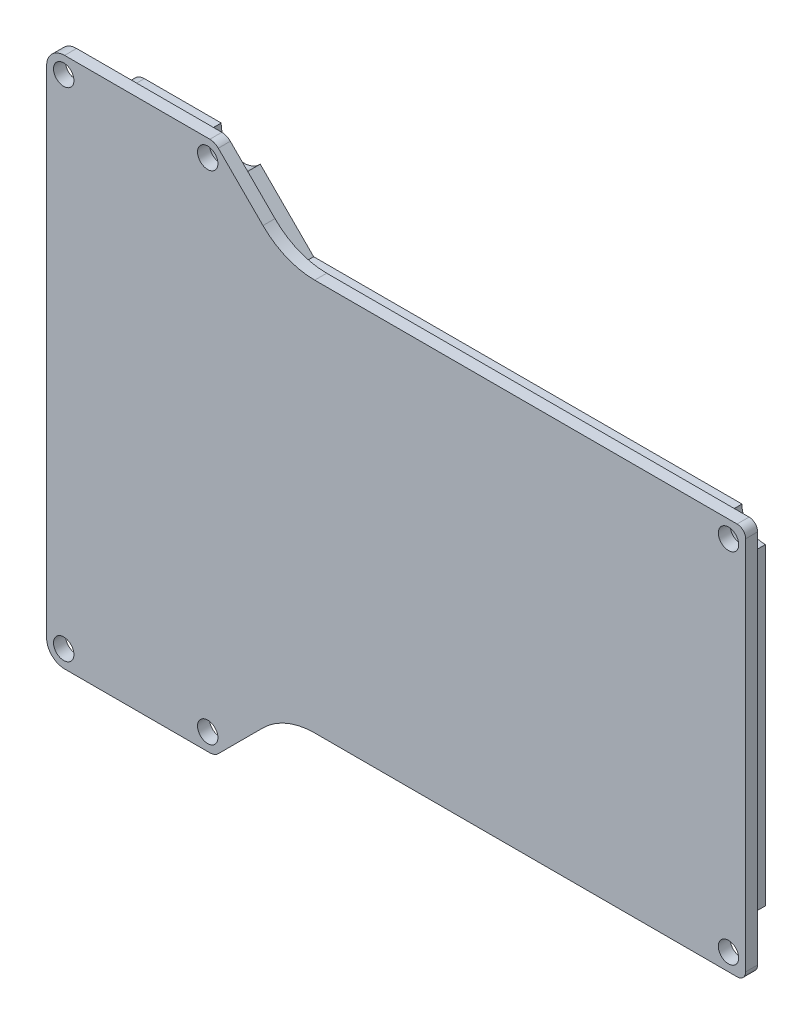
from build123d import *

# Parameters (mm, degrees)
BOSS_EXTRUDE1_DEPTH = 2
BOSS_EXTRUDE2_DEPTH = 4
SKETCH1_4_R         = 1.7
CUT_EXTRUDE1_DEPTH  = 10


with BuildPart() as part:
    # Sketch1 → Boss-Extrude1 (new body)
    with BuildSketch(Plane.XY):
        with BuildLine():
            Line((28.78011557, -21.498473491), (21.333027704, -14.051385626))
            ThreePointArc((21.333027704, -14.051385626), (20.684181007, -13.617840123), (19.918814142, -13.465599188))
            Line((19.918814142, -13.465599188), (-4.3, -13.465599188))
            ThreePointArc((-4.3, -13.465599188), (-6.421320344, -14.344278845), (-7.3, -16.465599188))
            Line((-7.3, -16.465599188), (-7.3, -99.073599188))
            ThreePointArc((-7.3, -99.073599188), (-6.421320344, -101.194919532), (-4.3, -102.073599188))
            Line((-4.3, -102.073599188), (19.918814142, -102.073599188))
            ThreePointArc((19.918814142, -102.073599188), (20.684181007, -101.921358253), (21.333027704, -101.48781275))
            Line((21.333027704, -101.48781275), (28.78511557, -94.035724885))
            ThreePointArc((28.78511557, -94.035724885), (32.741782732, -91.39196441), (37.408989873, -90.463599188))
            Line((37.408989873, -90.463599188), (107.834, -90.463599188))
            ThreePointArc((107.834, -90.463599188), (108.841627163, -90.046226351), (109.259, -89.038599188))
            Line((109.259, -89.038599188), (109.259, -26.495599188))
            ThreePointArc((109.259, -26.495599188), (108.841627163, -25.487972025), (107.834, -25.070599188))
            Line((107.834, -25.070599188), (37.403989873, -25.070599188))
            ThreePointArc((37.403989873, -25.070599188), (32.736782732, -24.142233967), (28.78011557, -21.498473491))
        make_face()
    extrude(amount=BOSS_EXTRUDE1_DEPTH)

    # Sketch1<3> → Boss-Extrude2 (add)
    with BuildSketch(Plane.XY):
        with BuildLine():
            Line((15.815448907, -16.169599188), (3, -16.169599188))
            ThreePointArc((3, -16.169599188), (1.51507576, -16.784674948), (0.9, -18.269599188))
            Line((0.9, -18.269599188), (0.9, -97.269599188))
            ThreePointArc((0.9, -97.269599188), (1.51507576, -98.754523429), (3, -99.369599188))
            Line((3, -99.369599188), (15.815448907, -99.369599188))
            ThreePointArc((15.815448907, -99.369599188), (18.129279051, -95.753279303), (22.322528351, -96.674278631))
            Line((22.322528351, -96.674278631), (31.237207794, -87.759599188))
            Line((31.237207794, -87.759599188), (102.655958934, -87.759599188))
            ThreePointArc((102.655958934, -87.759599188), (103.75222825, -84.956827438), (106.555, -83.860558122))
            Line((106.555, -83.860558122), (106.555, -31.673640255))
            ThreePointArc((106.555, -31.673640255), (103.75222825, -30.577370938), (102.655958934, -27.774599188))
            Line((102.655958934, -27.774599188), (31.232207794, -27.774599188))
            Line((31.232207794, -27.774599188), (22.322528351, -18.864919746))
            ThreePointArc((22.322528351, -18.864919746), (18.129279051, -19.785919074), (15.815448907, -16.169599188))
        make_face()
        with BuildLine():
            Line((22, -71.279599188), (90.115, -71.279599188))
            Line((90.115, -71.279599188), (104.755, -71.279599188))
            Line((104.755, -71.279599188), (104.755, -82.308711977))
            ThreePointArc((104.755, -82.308711977), (102.479436044, -83.684035232), (101.104112789, -85.959599188))
            Line((101.104112789, -85.959599188), (30.491623382, -85.959599188))
            Line((30.491623382, -85.959599188), (22.147057077, -94.304165492))
            ThreePointArc((22.147057077, -94.304165492), (17.440448873, -94.090296144), (14.263602762, -97.569599188))
            Line((14.263602762, -97.569599188), (3, -97.569599188))
            ThreePointArc((3, -97.569599188), (2.787867966, -97.481731222), (2.7, -97.269599188))
            Line((2.7, -97.269599188), (2.7, -71.279599188))
            Line((2.7, -71.279599188), (22, -71.279599188))
        make_face(mode=Mode.SUBTRACT)
        Polygon((22, -44.374599188), (90.115, -44.374599188), (104.755, -44.374599188), (104.755, -69.479599188), (90.115, -69.479599188), (22, -69.479599188), (2.7, -69.479599188), (2.7, -44.374599188), align=None, mode=Mode.SUBTRACT)
        with BuildLine():
            Line((104.755, -42.574599188), (90.115, -42.574599188))
            Line((90.115, -42.574599188), (22, -42.574599188))
            Line((22, -42.574599188), (2.7, -42.574599188))
            Line((2.7, -42.574599188), (2.7, -18.269599188))
            ThreePointArc((2.7, -18.269599188), (2.787867966, -18.057467154), (3, -17.969599188))
            Line((3, -17.969599188), (14.263602762, -17.969599188))
            ThreePointArc((14.263602762, -17.969599188), (17.440448873, -21.448902232), (22.147057077, -21.235032884))
            Line((22.147057077, -21.235032884), (30.486623382, -29.574599188))
            Line((30.486623382, -29.574599188), (101.104112789, -29.574599188))
            ThreePointArc((101.104112789, -29.574599188), (102.479436044, -31.850163144), (104.755, -33.225486399))
            Line((104.755, -33.225486399), (104.755, -42.574599188))
        make_face(mode=Mode.SUBTRACT)
    extrude(amount=-BOSS_EXTRUDE2_DEPTH)

    # Sketch1<4> → Cut-Extrude1 (cut)
    with BuildSketch(Plane.XY):
        with Locations((106.406, -27.923599188)):
            Circle(SKETCH1_4_R)
        with Locations((106.406, -87.610599188)):
            Circle(SKETCH1_4_R)
        with Locations((19.565489973, -99.220599188)):
            Circle(SKETCH1_4_R)
        with Locations((-4.447, -99.220599188)):
            Circle(SKETCH1_4_R)
        with Locations((-4.447, -16.318599188)):
            Circle(SKETCH1_4_R)
        with Locations((19.565489973, -16.318599188)):
            Circle(SKETCH1_4_R)
    extrude(amount=CUT_EXTRUDE1_DEPTH, mode=Mode.SUBTRACT)


solid = part.part
